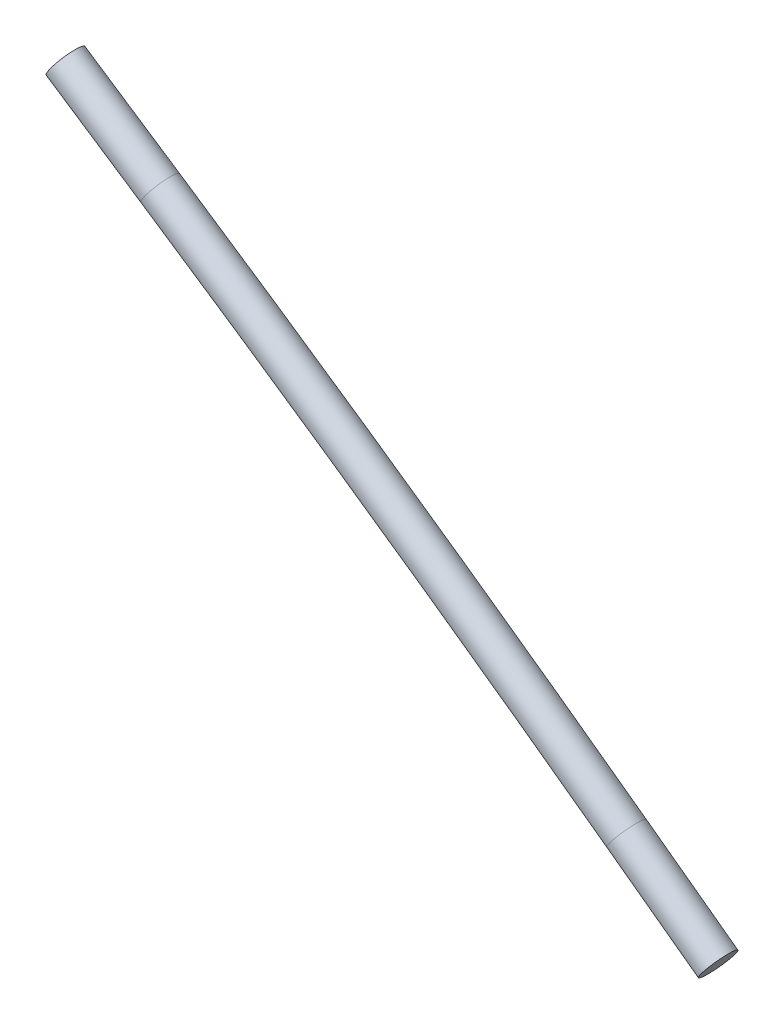
from build123d import *

# Parameters (mm, degrees)
VARREDURA1_PROFILE_R = 3


with BuildPart() as part:
    # Varredura1: sweep along a path in Esboço1
    with BuildLine(Plane.XY) as varredura1_path:
        Line((-45.410364748, 245.805534333), (-28.742484229, 234.751948534))
        ThreePointArc((-28.742484229, 234.751948534), (12.593352211, 206.614543827), (53.237327765, 177.486684844))
        Line((53.237327765, 177.486684844), (69.351800355, 165.640851266))
    # Varredura1 profile (on start of the path) → Varredura1 (sweep)
    with BuildSketch(Plane(origin=(-45.410364748, 245.805534333, 0), x_dir=(0.5526792899194641, 0.8333940259529804, 0), z_dir=(0.8333940259529804, -0.5526792899194641, 0))):
        Circle(VARREDURA1_PROFILE_R)
    sweep(path=varredura1_path.line)


solid = part.part
